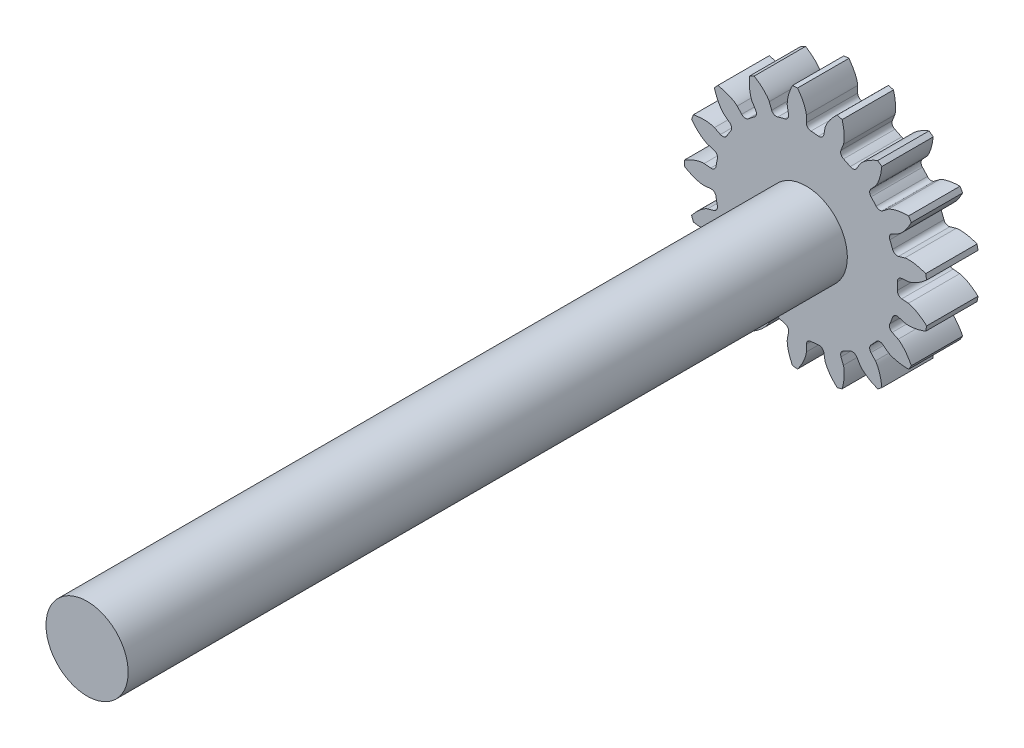
from build123d import *

# Parameters (mm, degrees)
BLANK_SKETCH_R      = 11.875
BLANK_DEPTH         = 5
TOOTH_SPACE_DEPTH   = 18.522307211
TEETH_COUNT         = 17
BORE_DEPTH          = 18.502023289
BORE_DEPTH_BACK     = 18.502023289
BORE_SKETCH_R       = 4
SKETCH1_R           = 4
BOSS_EXTRUDE1_DEPTH = 75


with BuildPart() as part:
    # Blank Sketch → Blank (new body)
    with BuildSketch(Plane.XY):
        Circle(BLANK_SKETCH_R)
    extrude(amount=BLANK_DEPTH)

    # Tooth Space Sketch → Tooth Space (cut, symmetric)
    with BuildSketch(Plane.XY):
        with BuildLine():
            Line((9.942364801, 0.91340716), (9.298767719, 0.854279759))
            ThreePointArc((9.298767719, 0.854279759), (8.984863997, 0.694192597), (8.867618155, 0.361902274))
            ThreePointArc((8.867618155, 0.361902274), (8.875, 0), (8.867618155, -0.361902274))
            ThreePointArc((8.867618155, -0.361902274), (8.984863997, -0.694192597), (9.298767719, -0.854279759))
            Line((9.298767719, -0.854279759), (9.942364801, -0.91340716))
            add(Edge.make_bspline(
                [(9.942364801, -0.91340716), (9.947707774, -0.913995463), (9.962658326, -0.915943937), (9.990773403, -0.92080477), (10.03637124, -0.930398576), (10.094010888, -0.945054989), (10.167889919, -0.966771469), (10.254035794, -0.995895766), (10.347670082, -1.031581288), (10.448308522, -1.074335805), (10.547535018, -1.120434221), (10.645345427, -1.169591339), (10.74167088, -1.221399901), (10.856958299, -1.28747082), (10.993207383, -1.371281114), (11.149344102, -1.475798759), (11.322581132, -1.601986981), (11.494732709, -1.73857283), (11.660412139, -1.879471881), (11.823262512, -2.029086969), (11.977584919, -2.17897923), (12.132897457, -2.341825663), (12.273746711, -2.495808162), (12.42574568, -2.675962445), (12.546739308, -2.823606943), (12.666700658, -2.982295404), (12.724336253, -3.060430467), (12.753472124, -3.10073762)],
                knots=[0, 0, 0, 0, 0, 0.005376748, 0.015083688, 0.02853182, 0.046610139, 0.064854849, 0.092110525, 0.119476176, 0.146842495, 0.174208854, 0.201574955, 0.228941013, 0.256307345, 0.307035032, 0.361767351, 0.41649966, 0.471231936, 0.525964282, 0.580696615, 0.635428982, 0.690161387, 0.744893688, 0.799626082, 0.854358408, 0.909090915, 0.909090915, 0.909090915, 0.909090915, 0.909090915], degree=4))
            Line((12.753472124, -3.10073762), (12.753472124, 3.10073762))
            add(Edge.make_bspline(
                [(9.942364801, 0.91340716), (9.947707774, 0.913995463), (9.962658326, 0.915943937), (9.990773403, 0.92080477), (10.03637124, 0.930398576), (10.094010888, 0.945054989), (10.167889919, 0.966771469), (10.254035794, 0.995895766), (10.347670082, 1.031581288), (10.448308522, 1.074335805), (10.547535018, 1.120434221), (10.645345427, 1.169591339), (10.74167088, 1.221399901), (10.856958299, 1.28747082), (10.993207383, 1.371281114), (11.149344102, 1.475798759), (11.322581132, 1.601986981), (11.494732709, 1.73857283), (11.660412139, 1.879471881), (11.823262512, 2.029086969), (11.977584919, 2.17897923), (12.132897457, 2.341825663), (12.273746711, 2.495808162), (12.42574568, 2.675962445), (12.546739308, 2.823606943), (12.666700658, 2.982295404), (12.724336253, 3.060430467), (12.753472124, 3.10073762)],
                knots=[0, 0, 0, 0, 0, 0.005376748, 0.015083688, 0.02853182, 0.046610139, 0.064854849, 0.092110525, 0.119476176, 0.146842495, 0.174208854, 0.201574955, 0.228941013, 0.256307345, 0.307035032, 0.361767351, 0.41649966, 0.471231936, 0.525964282, 0.580696615, 0.635428982, 0.690161387, 0.744893688, 0.799626082, 0.854358408, 0.909090915, 0.909090915, 0.909090915, 0.909090915, 0.909090915], degree=4))
        make_face()
    tooth_space = extrude(amount=TOOTH_SPACE_DEPTH, both=True, mode=Mode.SUBTRACT)

    # Teeth: Tooth Space ×17 about axis
    teeth_axis = Axis((0, 0, -3.75006405), (0, 0, 1))
    for i in range(1, TEETH_COUNT):
        add(tooth_space.rotate(teeth_axis, i * 360 / TEETH_COUNT), mode=Mode.SUBTRACT)

    # Bore Sketch → Bore (cut, two sides: drawn at the far end of the back side and taken through both)
    with BuildSketch(Plane.XY.offset(-BORE_DEPTH_BACK)):
        Circle(BORE_SKETCH_R)
    extrude(amount=BORE_DEPTH + BORE_DEPTH_BACK, mode=Mode.SUBTRACT)

    # Sketch1 → Boss-Extrude1 (add)
    with BuildSketch(Plane(origin=(0, 0, 0), x_dir=(-1, 0, 0), z_dir=(0, 0, -1))):
        Circle(SKETCH1_R)
    extrude(amount=-BOSS_EXTRUDE1_DEPTH)


solid = part.part
